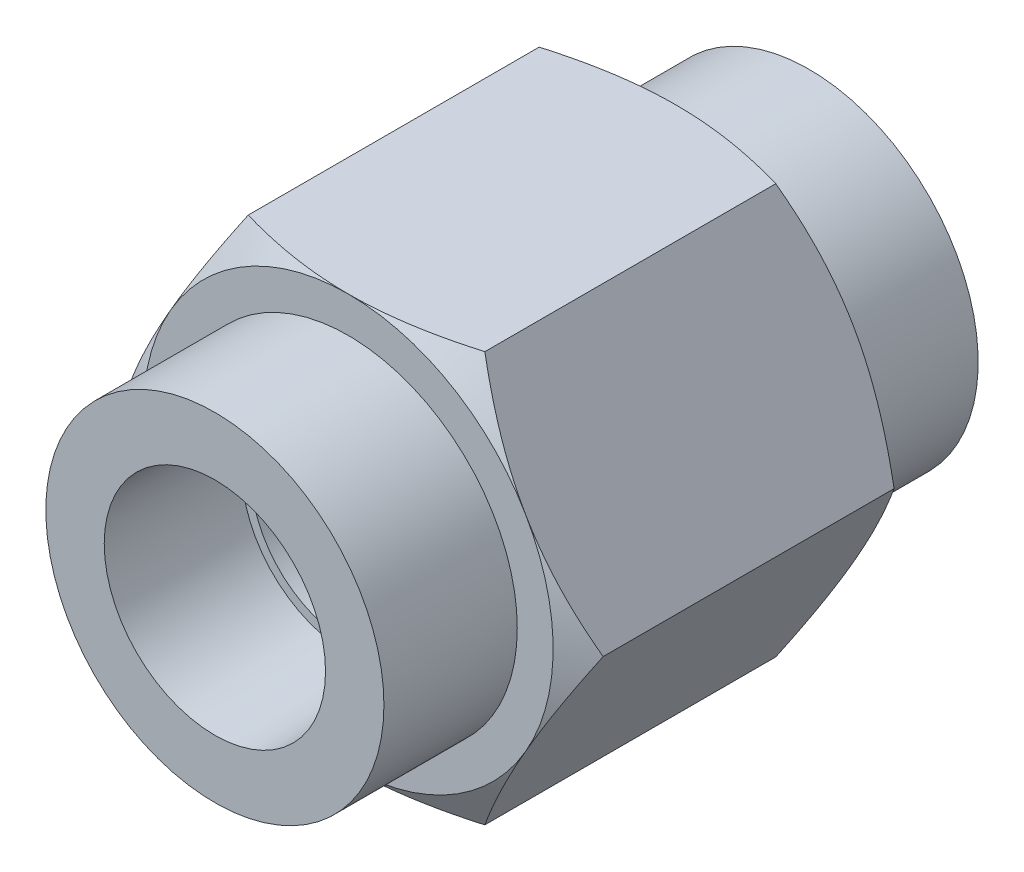
from build123d import *

# Parameters (mm, degrees)
BASE_DEPTH              = 23.01875
CUTSKETCH1_R            = 13.096875
SIDECUT_DEPTH           = 10.33018
SKETCH4_R               = 8.5725
CUT_EXTRUDE2_DEPTH      = 10.33018
CUT_EXTRUDE2_DRAFT      = -1.783333333
SKETCH5_R               = 7.5311
CUT_EXTRUDE3_DEPTH      = 23.01875
MIRROR1_COPY_1_SKETCH_R = 8.5725
MIRROR1_COPY_1_DEPTH    = 10.33018
MIRROR1_COPY_1_DRAFT    = -1.783333333


# Read off the part's stored shape, not the designer's step: Chamfer1
with BuildPart() as part:
    # BaseSketch → Base (new, symmetric)
    with BuildSketch(Plane.XY):
        Polygon((-9.165435523, 15.875), (9.165435523, 15.875), (18.330871047, 0), (9.165435523, -15.875), (-9.165435523, -15.875), (-18.330871047, 0), align=None)
    extrude(amount=BASE_DEPTH, both=True)

    # CutSketch1 → SideCut (cut)
    with BuildSketch(Plane.XY.offset(23.01875)):
        Polygon((9.165435523, -15.875), (18.330871047, 0), (9.165435523, 15.875), (-9.165435523, 15.875), (-18.330871047, 0), (-9.165435523, -15.875), align=None)
        Circle(CUTSKETCH1_R, mode=Mode.SUBTRACT)
    sidecut = extrude(amount=-SIDECUT_DEPTH, mode=Mode.SUBTRACT)


with BuildPart() as cut_extrude2_tool:
    # Sketch4 → Cut-Extrude2 (with draft: the straight prism first)
    with BuildSketch(Plane(origin=(-0.730245843, 0.065793184, 23.01875), x_dir=(1, 0, 0), z_dir=(0, 0, 1))):
        with Locations((0.730245843, -0.065793184)):
            Circle(SKETCH4_R)
    extrude(amount=-CUT_EXTRUDE2_DEPTH)
    # Cut-Extrude2: the draft: its side faces are tilted about the plane it starts from
    cut_extrude2_sides = [cut_extrude2_tool.faces().sort_by_distance(p)[0] for p in [
        (-8.5725, 0, 17.85366),
    ]]
    draft(cut_extrude2_sides, Plane(origin=(-0.730245843, 0.065793184, 23.01875), x_dir=(1, 0, 0), z_dir=(0, 0, 1)), CUT_EXTRUDE2_DRAFT)


with BuildPart() as part_1:
    add(part.part)

    # Cut-Extrude2: cut by cut_extrude2_tool
    add(cut_extrude2_tool.part, mode=Mode.SUBTRACT)

    # Sketch5 → Cut-Extrude3 (cut)
    with BuildSketch(Plane.XY.offset(23.01875)):
        Circle(SKETCH5_R)
    cut_extrude3 = extrude(amount=-CUT_EXTRUDE3_DEPTH, mode=Mode.SUBTRACT)

    # Cut-Extrude4 cone 1 section (through the dimple's axis) → Cut-Extrude4 (revolve, cut)
    with BuildSketch(Plane(origin=(0, 0, 0), x_dir=(0, -1, 0), z_dir=(1, 0, 0))):
        Polygon((0, 0), (7.5311, 0), (0, 4.348082612), align=None)
    revolve(axis=Axis((0, 0, 0), (0, 0, -1)), mode=Mode.SUBTRACT)

    # Chamfer1 outline → Chamfer1 (revolve, cut)
    with BuildSketch(Plane.XZ):
        Polygon((18.330871048, 12.68857), (15.875, 12.68857), (18.330871048, 11.270672189), align=None)
    chamfer1 = revolve(axis=Axis((0, 0, 0), (0, 0, 1)), mode=Mode.SUBTRACT)

    # Mirror1: SideCut, Cut-Extrude3, Chamfer1 across plane
    add(sidecut.mirror(Plane.XY), mode=Mode.SUBTRACT)
    add(cut_extrude3.mirror(Plane.XY), mode=Mode.SUBTRACT)
    add(chamfer1.mirror(Plane.XY), mode=Mode.SUBTRACT)


with BuildPart() as mirror1_copy_1_tool:
    # Mirror1 copy 1 sketch → Mirror1 copy 1 (with draft: the straight prism first)
    with BuildSketch(Plane(origin=(-0.730245843, 0.065793184, -23.01875), x_dir=(1, 0, 0), z_dir=(0, 0, -1))):
        with Locations((0.730245843, 0.065793184)):
            Circle(MIRROR1_COPY_1_SKETCH_R)
    extrude(amount=-MIRROR1_COPY_1_DEPTH)
    # Mirror1 copy 1: the draft: its side faces are tilted about the plane it starts from
    mirror1_copy_1_sides = [mirror1_copy_1_tool.faces().sort_by_distance(p)[0] for p in [
        (-8.5725, 0, -17.85366),
    ]]
    draft(mirror1_copy_1_sides, Plane(origin=(-0.730245843, 0.065793184, -23.01875), x_dir=(1, 0, 0), z_dir=(0, 0, -1)), MIRROR1_COPY_1_DRAFT)


with BuildPart() as part_2:
    add(part_1.part)

    # Mirror1 copy 1: cut by mirror1_copy_1_tool
    add(mirror1_copy_1_tool.part, mode=Mode.SUBTRACT)


solid = part_2.part
